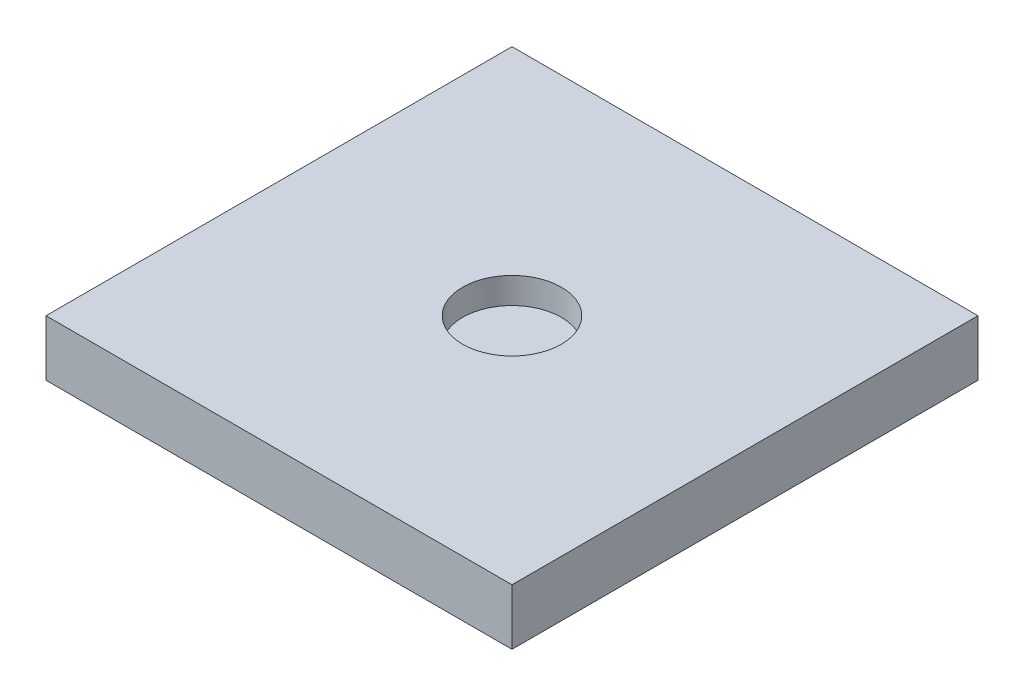
from build123d import *

# Parameters (mm, degrees)
SKETCH1_W           = 125
SKETCH1_H           = 125
SKETCH1_R           = 13.25
BOSS_EXTRUDE1_DEPTH = 15
SKETCH2_R           = 13.25
BOSS_EXTRUDE2_DEPTH = 8


with BuildPart() as part:
    # Sketch1 → Boss-Extrude1 (new body)
    with BuildSketch(Plane(origin=(0, 0, 0), x_dir=(1, 0, 0), z_dir=(0, 1, 0))):
        Rectangle(SKETCH1_W, SKETCH1_H)
        Circle(SKETCH1_R, mode=Mode.SUBTRACT)
    extrude(amount=BOSS_EXTRUDE1_DEPTH)

    # Sketch2 → Boss-Extrude2 (add)
    with BuildSketch(Plane.XZ):
        Circle(SKETCH2_R)
    extrude(amount=-BOSS_EXTRUDE2_DEPTH)


solid = part.part
